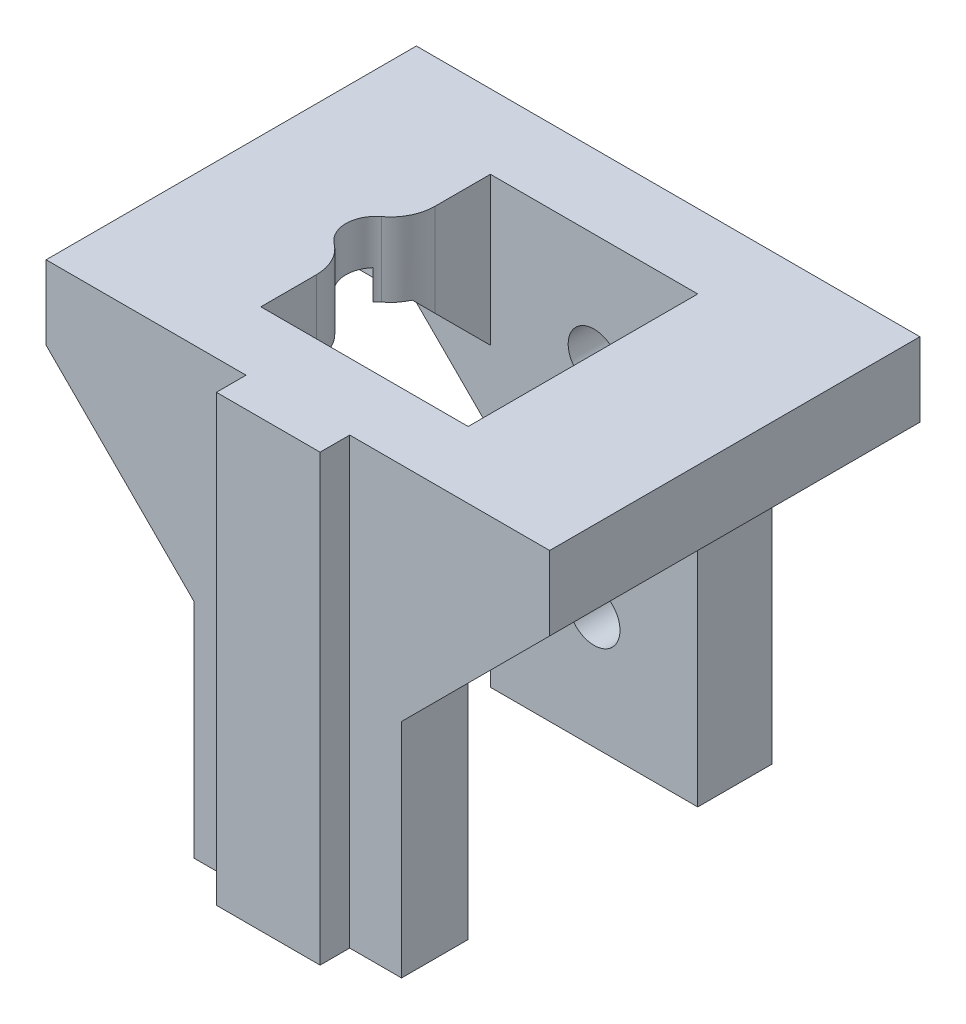
from build123d import *

# Parameters (mm, degrees)
BOSS_EXTRUDE1_DEPTH     = 5
SKETCH2_W               = 10
SKETCH2_H               = 5
BOSS_EXTRUDE2_DEPTH     = 15.5
BOSS_EXTRUDE3_DEPTH     = 6.5
CHAMFER1_SIZE           = 10
CHAMFER2_SIZE           = 5
CUT_EXTRUDE1_DEPTH      = 5
CUT_EXTRUDE1_DEPTH_BACK = 2
SKETCH4_R               = 3.75
SKETCH5_W               = 13.5
SKETCH5_H               = 30
CUT_EXTRUDE2_DEPTH      = 2
CHAMFER3_SIZE           = 1.5
SKETCH6_R               = 2
CUT_EXTRUDE4_DEPTH      = 44.794976881
FILLET1_R               = 3


with BuildPart() as part:
    # Sketch1 → Boss-Extrude1 (new body)
    with BuildSketch(Plane.XY):
        with BuildLine():
            Line((0, 24.45), (0, 30))
            Line((0, 30), (17, 30))
            Line((17, 30), (17, 25))
            Line((17, 25), (7, 25))
            Line((7, 25), (7, 0))
            Line((7, 0), (0, 0))
            Line((0, 0), (0, 5.95))
            ThreePointArc((0, 5.95), (1.75, 7.7), (0, 9.45))
            Line((0, 9.45), (0, 20.95))
            ThreePointArc((0, 20.95), (1.75, 22.7), (0, 24.45))
        make_face()
    extrude(amount=BOSS_EXTRUDE1_DEPTH)

    # Sketch2 → Boss-Extrude2 (add)
    with BuildSketch(Plane.XY.offset(5)):
        with Locations((12, 27.5)):
            Rectangle(SKETCH2_W, SKETCH2_H)
    extrude(amount=BOSS_EXTRUDE2_DEPTH)

    # Sketch3 → Boss-Extrude3 (add)
    with BuildSketch(Plane.XY.offset(20.5)):
        Polygon((7, 0), (7, 25), (17, 25), (17, 30), (0, 30), (0, 0), align=None)
    extrude(amount=BOSS_EXTRUDE3_DEPTH)

    # Chamfer1
    chamfer1_edges = [part.edges().sort_by_distance(p)[0] for p in [
        (7, 25, 2.5),
        (7, 25, 23.75),
    ]]
    chamfer(chamfer1_edges, length=CHAMFER1_SIZE - 0.0001)  # a hair under: the kernel refuses the full size

    # Chamfer2
    chamfer2_edges = [part.edges().sort_by_distance(p)[0] for p in [
        (11.99995, 25, 5),
        (11.99995, 25, 20.5),
    ]]
    chamfer(chamfer2_edges, length=CHAMFER2_SIZE)

    # Sketch4 → Cut-Extrude1 (cut, two sides: drawn at the far end of the back side and taken through both)
    with BuildSketch(Plane.XZ.offset(-25).offset(-CUT_EXTRUDE1_DEPTH_BACK)):
        with Locations(Location((12, 12.75, 0), (0, 0, 132.833428066))):
            Circle(SKETCH4_R)
    extrude(amount=CUT_EXTRUDE1_DEPTH + CUT_EXTRUDE1_DEPTH_BACK, mode=Mode.SUBTRACT)

    # Mirror1: part across plane


with BuildPart() as part_1:
    add(part.part)
    add(part.part.mirror(Plane(origin=(0, 30, 27), x_dir=(0, 0, 1), z_dir=(1, 0, 0))))

    # Sketch5 → Cut-Extrude2 (cut)
    with BuildSketch(Plane.XY.offset(27)):
        with Locations((-10.25, 15)):
            Rectangle(SKETCH5_W, SKETCH5_H)
        with Locations((10.25, 15)):
            Rectangle(SKETCH5_W, SKETCH5_H)
    extrude(amount=-CUT_EXTRUDE2_DEPTH, mode=Mode.SUBTRACT)

    # Chamfer3
    chamfer3_edges = [part_1.edges().sort_by_distance(p)[0] for p in [
        (0, 9.45, 0),
        (0, 24.45, 0),
    ]]
    chamfer(chamfer3_edges, length=CHAMFER3_SIZE)

    # Sketch6 → Cut-Extrude4 (cut, through all)
    with BuildSketch(Plane(origin=(0, 30, 0), x_dir=(1, 0, 0), z_dir=(0, 1, 0))):
        with Locations((-7, -12.75)):
            Circle(SKETCH6_R)
    extrude(amount=-CUT_EXTRUDE4_DEPTH, mode=Mode.SUBTRACT)

    # Fillet1
    fillet1_edges = [part_1.edges().sort_by_distance(p)[0] for p in [
        (-7, 27.5, 14.75),
        (-7, 27.5, 10.75),
    ]]
    fillet(fillet1_edges, radius=FILLET1_R)


solid = part_1.part
